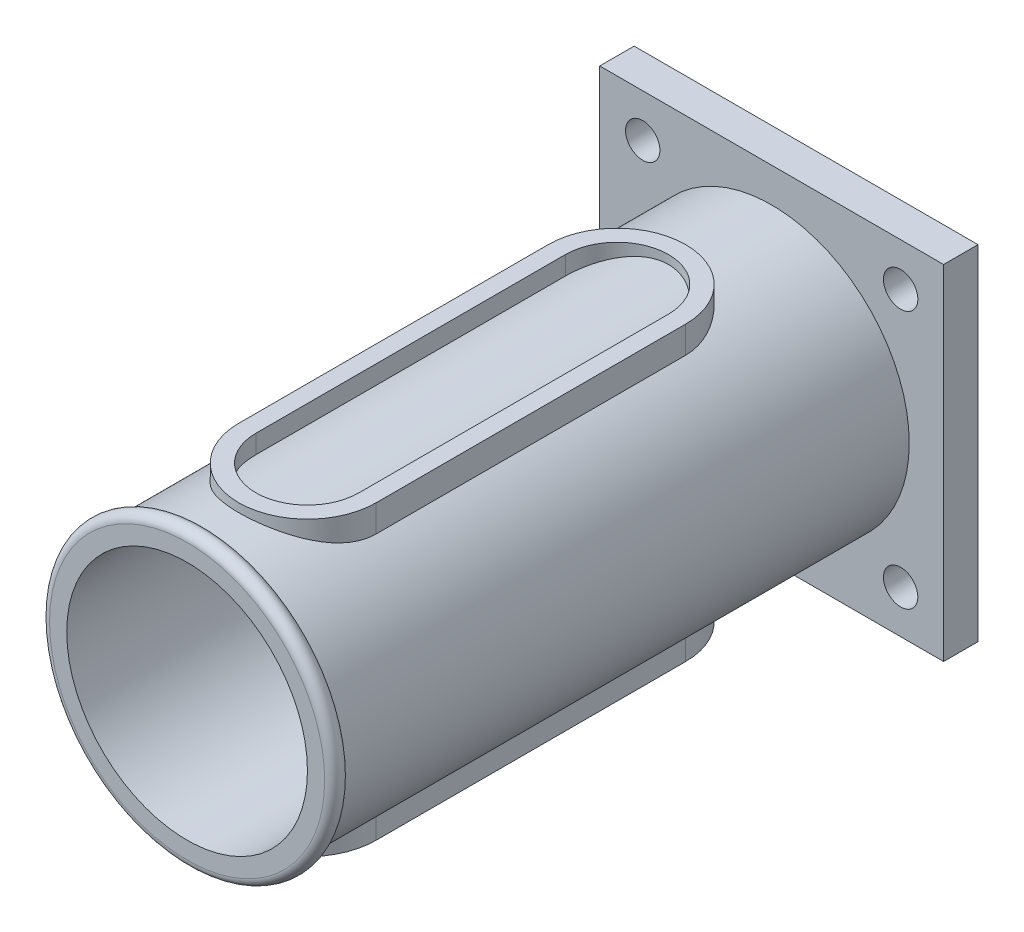
from build123d import *

# Parameters (mm, degrees)
SKETCH2_W                     = 63.5
SKETCH2_H                     = 63.5
SKETCH2_R                     = 22.225
BOSS_EXTRUDE1_DEPTH           = 6.35
SKETCH3_R                     = 25.4
SKETCH3_R_2                   = 22.225
BOSS_EXTRUDE2_DEPTH           = 101.6
SKETCH4_W                     = 63.5
SKETCH4_H                     = 63.5
SKETCH4_R                     = 22.225
BOSS_EXTRUDE3_DEPTH           = 6.35
F_3_0_25_DIAMETER_HOLE1_D     = 6.35
F_3_0_25_DIAMETER_HOLE1_DEPTH = 6.35
SKETCH8_W                     = 63.5
SKETCH8_H                     = 63.5
CUT_EXTRUDE1_DEPTH            = 3.175
BOSS_EXTRUDE4_REACH           = 118.916
SKETCH9_R                     = 25.4
SKETCH9_R_2                   = 22.225
SKETCH10_OUTSIDE_W            = 94.572
SKETCH10_OUTSIDE_H            = 94.572
SKETCH10_OUTSIDE_R            = 26.9875
CUT_EXTRUDE2_DEPTH            = 3.175
FILLET1_R                     = 1.5875
BOSS_EXTRUDE5_DEPTH           = 26.9875
CUT_EXTRUDE3_DEPTH            = 123.80315559
CUT_EXTRUDE3_DEPTH_BACK       = 123.80315559
SKETCH12_R                    = 22.225


with BuildPart() as part:
    # Sketch2 → Boss-Extrude1 (new body)
    with BuildSketch(Plane.XY):
        Rectangle(SKETCH2_W, SKETCH2_H)
        Circle(SKETCH2_R, mode=Mode.SUBTRACT)
    extrude(amount=BOSS_EXTRUDE1_DEPTH)

    # Sketch3 → Boss-Extrude2 (add)
    with BuildSketch(Plane.XY.offset(6.35)):
        with Locations(Location((0, 0, 0), (0, 0, 180))):
            Circle(SKETCH3_R)
        Circle(SKETCH3_R_2, mode=Mode.SUBTRACT)
    extrude(amount=BOSS_EXTRUDE2_DEPTH)

    # Sketch4 → Boss-Extrude3 (add)
    with BuildSketch(Plane.XY.offset(107.95)):
        Rectangle(SKETCH4_W, SKETCH4_H)
        Circle(SKETCH4_R, mode=Mode.SUBTRACT)
    extrude(amount=BOSS_EXTRUDE3_DEPTH)

    # #3 (0.25) Diameter Hole1
    with Locations(Plane(origin=(0, 0, 0), x_dir=(-1, 0, 0), z_dir=(0, 0, -1))):
        with Locations((-23.8125, 23.8125), (-23.8125, -23.8125), (23.8125, -23.8125), (23.8125, 23.8125)):
            Hole(F_3_0_25_DIAMETER_HOLE1_D / 2, depth=F_3_0_25_DIAMETER_HOLE1_DEPTH)

    # Sketch8 → Cut-Extrude1 (cut)
    with BuildSketch(Plane(origin=(0, 0, 107.95), x_dir=(-1, 0, 0), z_dir=(0, 0, -1))):
        Rectangle(SKETCH8_W, SKETCH8_H)
    extrude(amount=-CUT_EXTRUDE1_DEPTH, mode=Mode.SUBTRACT)


with BuildPart() as cut_extrude1_piece_1:
    # of the separate pieces the step leaves, piece 1, a body of its own (cut_extrude1_pieces)
    add(part.part.solids().sort_by_distance((-31.75, -31.75, 0))[0])


with BuildPart() as cut_extrude1_piece_2:
    # of the separate pieces the step leaves, piece 2, a body of its own (cut_extrude1_pieces)
    add(part.part.solids().sort_by_distance((22.225, 0, 111.125))[0])

    # Sketch9 → Boss-Extrude4 (add, up to next)
    with BuildSketch(Plane.XY.offset(107.95), mode=Mode.PRIVATE) as boss_extrude4_sk1:
        with Locations(Location((0, 0, 0), (0, 0, 180))):
            Circle(SKETCH9_R)
        Circle(SKETCH9_R_2, mode=Mode.SUBTRACT)
    boss_extrude4_tool1 = extrude(boss_extrude4_sk1.sketch, amount=BOSS_EXTRUDE4_REACH, mode=Mode.PRIVATE) - cut_extrude1_piece_2.part

    add(cut_extrude1_piece_1.part)  # Boss-Extrude4 merges Cut-Extrude1 piece 1
    add(boss_extrude4_tool1.solids().sort_by_distance((24.68158, 0, 107.95))[0])

    # Sketch10 outside → Cut-Extrude2 (cut)
    with BuildSketch(Plane.XY.offset(114.3)):
        Rectangle(SKETCH10_OUTSIDE_W, SKETCH10_OUTSIDE_H)
        Circle(SKETCH10_OUTSIDE_R, mode=Mode.SUBTRACT)
    extrude(amount=-CUT_EXTRUDE2_DEPTH, mode=Mode.SUBTRACT)

    # Fillet1
    fillet1_edges = [cut_extrude1_piece_2.edges().sort_by_distance(p)[0] for p in [
        (-26.9875, 0, 111.125),
        (-26.9875, 0, 114.3),
    ]]
    fillet(fillet1_edges, radius=FILLET1_R - 0.0001)  # a hair under: the kernel refuses the full size

    # Sketch11 → Boss-Extrude5 (add)
    with BuildSketch(Plane(origin=(0, 0, 0), x_dir=(1, 0, 0), z_dir=(0, 1, 0))):
        with BuildLine():
            Line((-12.7, -92.075), (-12.7, -34.925))
            ThreePointArc((-12.7, -34.925), (0, -22.225), (12.7, -34.925))
            Line((12.7, -34.925), (12.7, -92.075))
            ThreePointArc((12.7, -92.075), (0, -104.775), (-12.7, -92.075))
        make_face()
        with BuildLine():
            Line((-9.525, -92.075), (-9.525, -34.925))
            ThreePointArc((-9.525, -34.925), (0, -25.4), (9.525, -34.925))
            Line((9.525, -34.925), (9.525, -92.075))
            ThreePointArc((9.525, -92.075), (0, -101.6), (-9.525, -92.075))
        make_face(mode=Mode.SUBTRACT)
    boss_extrude5 = extrude(amount=BOSS_EXTRUDE5_DEPTH)

    # Mirror1: Boss-Extrude5 across plane
    add(boss_extrude5.mirror(Plane.ZX))

    # Sketch12 → Cut-Extrude3 (cut, two sides: drawn at the far end of the back side and taken through both)
    with BuildSketch(Plane(origin=(0, 0, 0), x_dir=(-1, 0, 0), z_dir=(0, 0, -1)).offset(-CUT_EXTRUDE3_DEPTH_BACK)):
        with Locations(Location((0, 0, 0), (0, 0, 180))):
            Circle(SKETCH12_R)
    extrude(amount=CUT_EXTRUDE3_DEPTH + CUT_EXTRUDE3_DEPTH_BACK, mode=Mode.SUBTRACT)


solid = cut_extrude1_piece_2.part
